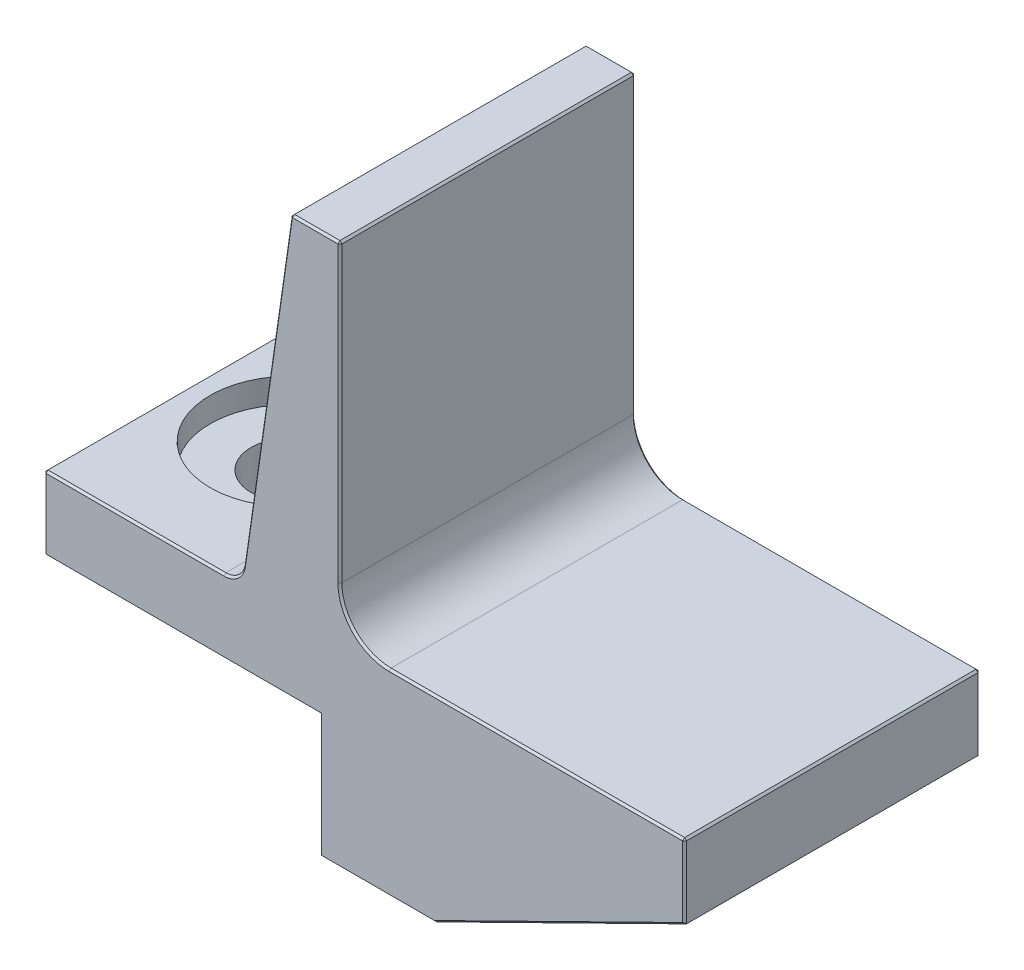
from build123d import *
from OCP.BRepFilletAPI import BRepFilletAPI_MakeChamfer

# Parameters (mm, degrees)
BOSS_EXTRUDE1_DEPTH                                  = 38.1
CBORE_FOR_3_8_BINDING_HEAD_MACHINE_SCREW_D           = 10.0838
CBORE_FOR_3_8_BINDING_HEAD_MACHINE_SCREW_CBORE_D     = 20.6375
CBORE_FOR_3_8_BINDING_HEAD_MACHINE_SCREW_CBORE_DEPTH = 3.175
FILLET1_R                                            = 2.54
FILLET2_R                                            = 6.35
CHAMFER1_SIZE                                        = 0.254
CHAMFER1_SIZE2                                       = 0.299878075


with BuildPart() as part:
    # Sketch1 → Boss-Extrude1 (new body)
    with BuildSketch(Plane.XY):
        Polygon((0, 0), (44.45, 0), (44.45, -9.525), (12.255661671, -25.4), (-2.6008076, -25.4), (-2.6008076, -9.525), (-38.1608076, -9.525), (-38.1608076, 0), (-12.7608076, 0), (-6.35, 44.45), (0, 44.45), align=None)
    extrude(amount=BOSS_EXTRUDE1_DEPTH)

    # CBORE for 3/8 Binding Head Machine Screw1 (through all)
    with Locations(Plane(origin=(0, 0, 0), x_dir=(1, 0, 0), z_dir=(0, 1, 0))):
        with Locations((-25.4608076, -19.05)):
            CounterBoreHole(CBORE_FOR_3_8_BINDING_HEAD_MACHINE_SCREW_D / 2, CBORE_FOR_3_8_BINDING_HEAD_MACHINE_SCREW_CBORE_D / 2, CBORE_FOR_3_8_BINDING_HEAD_MACHINE_SCREW_CBORE_DEPTH)

    # Fillet1
    fillet1_edges = [part.edges().sort_by_distance(p)[0] for p in [
        (-12.7608076, 0, 19.05),
    ]]
    fillet(fillet1_edges, radius=FILLET1_R)

    # Fillet2
    fillet2_edges = [part.edges().sort_by_distance(p)[0] for p in [
        (0, 0, 19.05),
    ]]
    fillet(fillet2_edges, radius=FILLET2_R)

    # Chamfer1: one chamfer whose edges measure the first distance from different faces: ONE call of the kernel's chamfer builder (chamfer() names one face for all edges)
    chamfer1_edges_1 = [part.edges().sort_by_distance(p)[0] for p in [
        (-6.35, 44.45, 19.05),
    ]]
    chamfer1_side_1 = [part.faces().sort_by_distance(p)[0] for p in [
        (-3.175, 44.45, 19.05),
    ]]
    chamfer1_edges_2 = [part.edges().sort_by_distance(p)[0] for p in [
        (-3.175, 44.45, 0),
        (-3.175, 44.45, 38.1),
        (0, 44.45, 19.05),
        (-9.398384465, 23.313709862, 0),
        (-9.398384465, 23.313709862, 38.1),
        (-13.297830854, 0.620032045, 0),
        (-13.297830854, 0.620032045, 38.1),
        (-26.560782253, 0, 0),
        (-38.1608076, 0, 19.05),
        (-26.560782253, 0, 38.1),
        (-38.1608076, -4.7625, 0),
        (-38.1608076, -9.525, 19.05),
        (-38.1608076, -4.7625, 38.1),
        (-20.3808076, -9.525, 0),
        (-20.3808076, -9.525, 38.1),
        (44.45, -4.7625, 0),
        (44.45, -4.7625, 38.1),
        (44.45, 0, 19.05),
        (25.4, 0, 0),
        (1.859871939, 1.859871939, 0),
        (1.859871939, 1.859871939, 38.1),
        (0, 25.4, 0),
        (0, 25.4, 38.1),
        (25.4, 0, 38.1),
        (-2.6008076, -17.4625, 0),
        (-2.6008076, -17.4625, 38.1),
        (4.827427036, -25.4, 0),
        (4.827427036, -25.4, 38.1),
        (28.352830836, -17.4625, 0),
        (28.352830836, -17.4625, 38.1),
    ]]
    chamfer1 = BRepFilletAPI_MakeChamfer(part.part.solid().wrapped)
    for e in chamfer1_edges_1:
        chamfer1.Add(CHAMFER1_SIZE, CHAMFER1_SIZE2, e.wrapped, chamfer1_side_1[0].wrapped)  # the first distance lies on this face
    for e in chamfer1_edges_2:
        chamfer1.Add(CHAMFER1_SIZE, e.wrapped)
    add(Compound.cast(chamfer1.Shape()), mode=Mode.REPLACE)


solid = part.part
